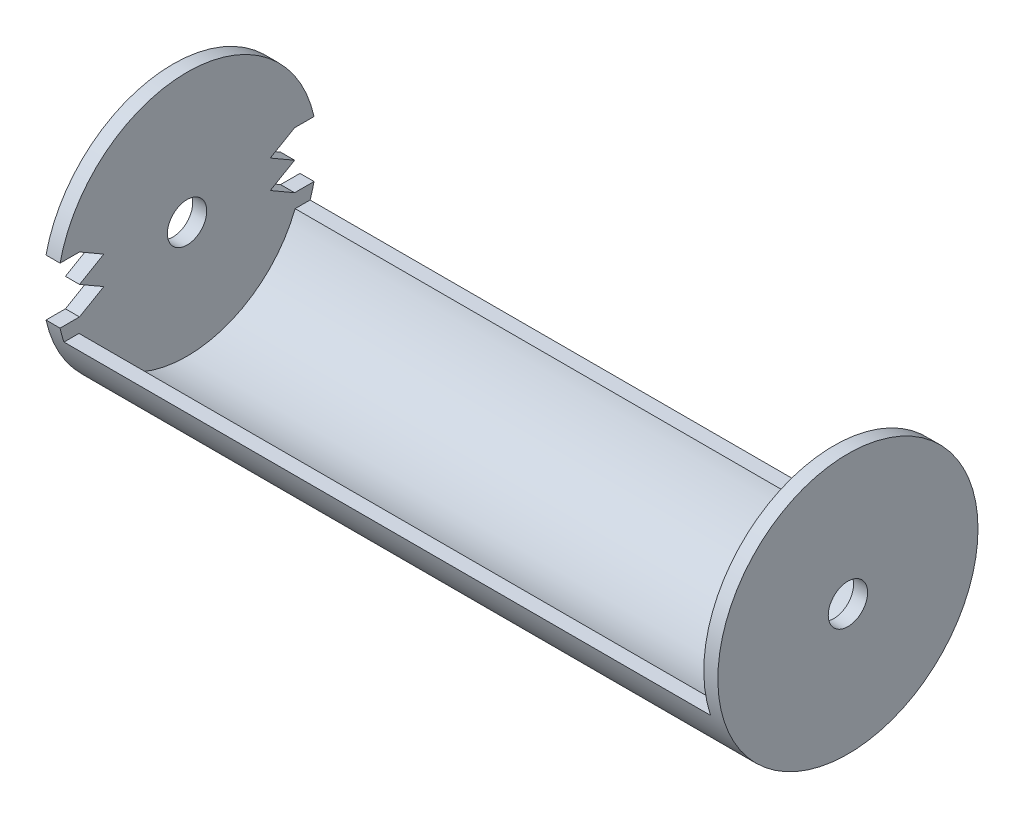
from build123d import *

# Parameters (mm, degrees)
SKETCH1_R               = 58.7375
SKETCH1_R_2             = 8.89
BOSS_EXTRUDE1_DEPTH     = 152.4
CUT_EXTRUDE1_DEPTH      = 174.568279972
CUT_EXTRUDE1_DEPTH_BACK = 174.568279972
SKETCH2_W               = 292.1
SKETCH2_H               = 77.7875
SHELL1_START            = -146.05
SHELL1_DEPTH            = 292.1
CUT_EXTRUDE2_DEPTH      = 12.7


# Read off the part's stored shape, not the designer's step: Shell1
with BuildPart() as part:
    # Sketch1 → Boss-Extrude1 (new, symmetric)
    with BuildSketch(Plane(origin=(0, 0, 0), x_dir=(0, 0, -1), z_dir=(1, 0, 0))):
        with Locations(Location((0, 0, 0), (0, 0, 180))):
            Circle(SKETCH1_R)
        with Locations(Location((0, 0, 0), (0, 0, 180))):
            Circle(SKETCH1_R_2, mode=Mode.SUBTRACT)
    extrude(amount=BOSS_EXTRUDE1_DEPTH, both=True)

    # Sketch2 → Cut-Extrude1 (cut, two sides: drawn at the far end of the back side and taken through both)
    with BuildSketch(Plane.XY.offset(-CUT_EXTRUDE1_DEPTH_BACK)):
        with Locations((0, 19.84375)):
            Rectangle(SKETCH2_W, SKETCH2_H)
    extrude(amount=CUT_EXTRUDE1_DEPTH + CUT_EXTRUDE1_DEPTH_BACK, mode=Mode.SUBTRACT)

    # Shell1 outline → Shell1 (cut)
    with BuildSketch(Plane.YZ.offset(SHELL1_START)):
        with BuildLine():
            ThreePointArc((-19.05, 48.801103023), (-52.3875, 0), (-19.05, -48.801103023))
            Line((-19.05, -48.801103023), (-19.05, 48.801103023))
        make_face()
    extrude(amount=SHELL1_DEPTH, mode=Mode.SUBTRACT)

    # Sketch3 → Cut-Extrude2 (cut)
    with BuildSketch(Plane.ZY.offset(152.4)):
        Polygon((-48.5775, 12.7), (-37.578977372, 6.35), (-48.5775, 0), (-37.578977372, -6.35), (-48.5775, -12.7), (-58.7375, -12.7), (-58.7375, 12.7), align=None)
        Polygon((48.5775, 12.7), (58.7375, 12.7), (58.7375, -12.7), (48.5775, -12.7), (37.578977372, -6.35), (48.5775, 0), (37.578977372, 6.35), align=None)
    extrude(amount=-CUT_EXTRUDE2_DEPTH, mode=Mode.SUBTRACT)


solid = part.part
